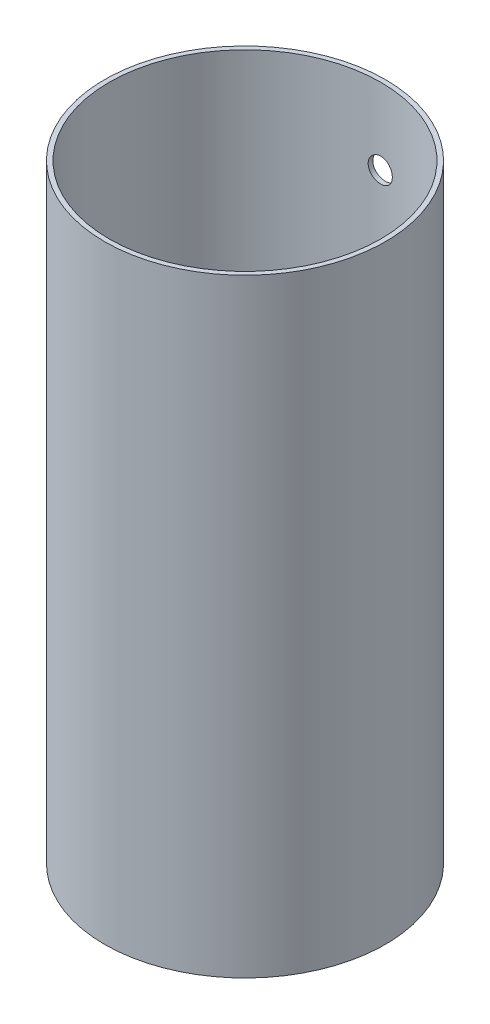
from build123d import *

# Parameters (mm, degrees)
SKETCH1_R           = 76.1746
SKETCH1_R_2         = 73.66
BOSS_EXTRUDE1_DEPTH = 330.2


with BuildPart() as part:
    # Sketch1 → Boss-Extrude1 (new body)
    with BuildSketch(Plane(origin=(0, 0, 0), x_dir=(1, 0, 0), z_dir=(0, 1, 0))):
        Circle(SKETCH1_R)
        Circle(SKETCH1_R_2, mode=Mode.SUBTRACT)
    extrude(amount=BOSS_EXTRUDE1_DEPTH)

    # Sketch17 → 1/2 Clearance Hole5 (revolve, cut)
    with BuildSketch(Plane(origin=(0, 288.925, 0), x_dir=(0, -1, 0), z_dir=(1, 0, 0))):
        Polygon((0, 0), (0, 80.134507437), (6.54812, 76.2), (6.54812, 0), align=None)
    revolve(axis=Axis((0, 288.925, 6.35), (0, 0, -1)), mode=Mode.SUBTRACT)

    # Sketch21 → 1/2 Clearance Hole7 (revolve, cut)
    with BuildSketch(Plane(origin=(0, 41.275, 0), x_dir=(0, -1, 0), z_dir=(1, 0, 0))):
        Polygon((0, 0), (0, 80.134507437), (6.54812, 76.2), (6.54812, 0), align=None)
    revolve(axis=Axis((0, 41.275, 6.35), (0, 0, -1)), mode=Mode.SUBTRACT)


solid = part.part
